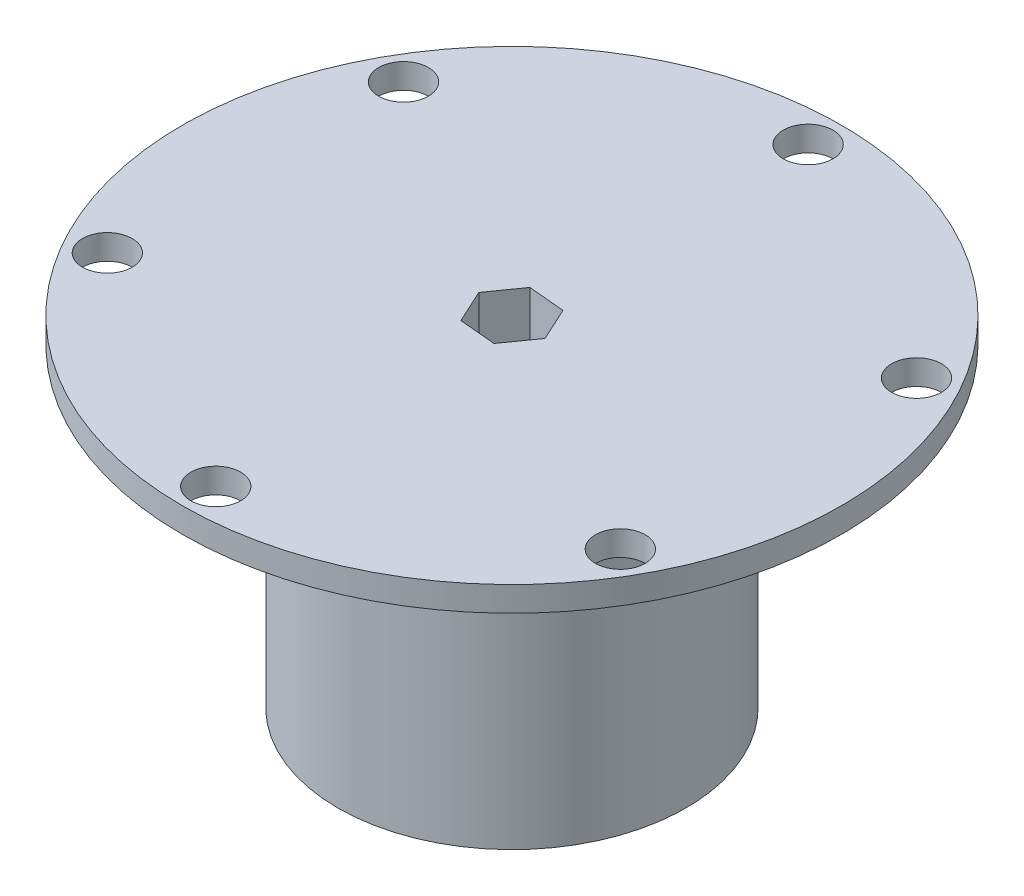
from build123d import *

# Parameters (mm, degrees)
SKETCH1_R           = 14
BOSS_EXTRUDE1_DEPTH = 25.3
SKETCH2_R           = 26.5
BOSS_EXTRUDE2_DEPTH = 2
SKETCH3_R           = 2
CUT_EXTRUDE1_DEPTH  = 32


with BuildPart() as part:
    # Sketch1 → Boss-Extrude1 (new body)
    with BuildSketch(Plane(origin=(0, 0, 0), x_dir=(1, 0, 0), z_dir=(0, 1, 0))):
        Circle(SKETCH1_R)
    extrude(amount=BOSS_EXTRUDE1_DEPTH)

    # Sketch2 → Boss-Extrude2 (add)
    with BuildSketch(Plane(origin=(0, 25.3, 0), x_dir=(1, 0, 0), z_dir=(0, 1, 0))):
        Circle(SKETCH2_R)
    extrude(amount=BOSS_EXTRUDE2_DEPTH)

    # Sketch3 → Cut-Extrude1 (cut)
    with BuildSketch(Plane(origin=(0, 27.3, 0), x_dir=(1, 0, 0), z_dir=(0, 1, 0))):
        with Locations((0, 23.815)):
            Circle(SKETCH3_R)
        with Locations((20.624394991, 11.9075)):
            Circle(SKETCH3_R)
        with Locations((20.624394991, -11.9075)):
            Circle(SKETCH3_R)
        with Locations((0, -23.815)):
            Circle(SKETCH3_R)
        with Locations((-20.624394991, -11.9075)):
            Circle(SKETCH3_R)
        with Locations((-20.624394991, 11.9075)):
            Circle(SKETCH3_R)
        Polygon((1.234520104, -2.673192869), (2.932312985, -0.267470663), (1.697792881, 2.405722206), (-1.234520104, 2.673192869), (-2.932312985, 0.267470663), (-1.697792881, -2.405722206), align=None)
    extrude(amount=-CUT_EXTRUDE1_DEPTH, mode=Mode.SUBTRACT)


solid = part.part
